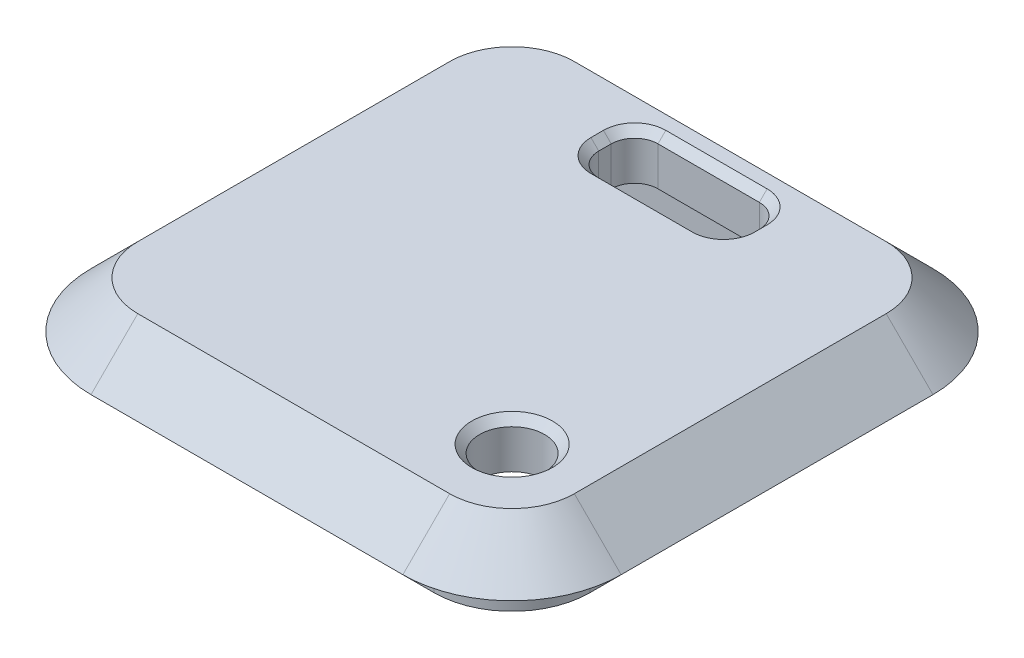
from build123d import *

# Parameters (mm, degrees)
CROQUIS1_W              = 34
CROQUIS1_H              = 34
SALIENTE_EXTRUIR1_DEPTH = 3
REDONDEO1_R             = 7
CHAFL_N1_SIZE           = 3
CROQUIS2_R              = 2.087433524
CROQUIS2_W              = 9.5
CROQUIS2_H              = 3.8
CORTAR_EXTRUIR1_DEPTH   = 25.228082879
REDONDEO2_R             = 1.5
CHAFL_N2_SIZE           = 0.5
SALIENTE_EXTRUIR2_DEPTH = 5
REDONDEO3_R             = 0.2
REDONDEO4_R             = 0.2
REDONDEO5_R             = 10
SALIENTE_EXTRUIR3_DEPTH = 2


with BuildPart() as part:
    # Croquis1 → Saliente-Extruir1 (new body)
    with BuildSketch(Plane(origin=(0, 0, 0), x_dir=(1, 0, 0), z_dir=(0, 1, 0))):
        Rectangle(CROQUIS1_W, CROQUIS1_H)
    extrude(amount=SALIENTE_EXTRUIR1_DEPTH)

    # Redondeo1
    redondeo1_edges = [part.edges().sort_by_distance(p)[0] for p in [
        (17, 1.5, 17),
        (-17, 1.5, 17),
        (-17, 1.5, -17),
        (17, 1.5, -17),
    ]]
    fillet(redondeo1_edges, radius=REDONDEO1_R)

    # Chaflán1
    chafl_n1_edges = [part.edges().sort_by_distance(p)[0] for p in [
        (17, 3, 0),
        (14.949747468, 3, -14.949747468),
        (14.949747468, 3, 14.949747468),
        (0, 3, -17),
        (0, 3, 17),
        (-14.949747468, 3, -14.949747468),
        (-14.949747468, 3, 14.949747468),
        (-17, 3, 0),
    ]]
    chamfer(chafl_n1_edges, length=CHAFL_N1_SIZE - 0.0001)  # a hair under: the kernel refuses the full size

    # Croquis2 → Cortar-Extruir1 (cut, through all)
    with BuildSketch(Plane(origin=(0, 3, 0), x_dir=(1, 0, 0), z_dir=(0, 1, 0))):
        with Locations(Location((9.259969099, -9.25223211, 0), (0, 0, 270))):
            Circle(CROQUIS2_R)
        with Locations((0, 10.712955835)):
            Rectangle(CROQUIS2_W, CROQUIS2_H)
    extrude(amount=-CORTAR_EXTRUIR1_DEPTH, mode=Mode.SUBTRACT)

    # Redondeo2
    redondeo2_edges = [part.edges().sort_by_distance(p)[0] for p in [
        (4.75, 1.5, -12.612955835),
        (4.75, 1.5, -8.812955835),
        (-4.75, 1.5, -8.812955835),
        (-4.75, 1.5, -12.612955835),
    ]]
    fillet(redondeo2_edges, radius=REDONDEO2_R)

    # Chaflán2
    chafl_n2_edges = [part.edges().sort_by_distance(p)[0] for p in [
        (9.259969099, 3, 7.164798586),
        (0, 3, -8.812955835),
        (-4.75, 3, -10.712955835),
        (4.75, 3, -10.712955835),
        (0, 3, -12.612955835),
        (-4.310660172, 3, -9.252295663),
        (4.310660172, 3, -9.252295663),
        (4.310660172, 3, -12.173616007),
        (-4.310660172, 3, -12.173616007),
    ]]
    chamfer(chafl_n2_edges, length=CHAFL_N2_SIZE)

    # Croquis3 → Saliente-Extruir2 (add, symmetric)
    with BuildSketch(Plane.XY):
        Polygon((-15.871019058, -6.008290377), (-14.471019058, -5.2), (-14.471019058, -3), (-15, 0), (-13, 0), (-12.471019058, -3), (-13, -8), align=None)
    extrude(amount=SALIENTE_EXTRUIR2_DEPTH, both=True)

    # Redondeo3
    redondeo3_edges = [part.edges().sort_by_distance(p)[0] for p in [
        (-13, -8, 0),
    ]]
    fillet(redondeo3_edges, radius=REDONDEO3_R)

    # Redondeo4
    redondeo4_edges = [part.edges().sort_by_distance(p)[0] for p in [
        (-15.871019058, -6.008290377, 0),
    ]]
    fillet(redondeo4_edges, radius=REDONDEO4_R)

    # Redondeo5
    redondeo5_edges = [part.edges().sort_by_distance(p)[0] for p in [
        (-14.471019058, -3, 0),
        (-12.471019058, -3, 0),
    ]]
    fillet(redondeo5_edges, radius=REDONDEO5_R)

    # Croquis4 → Saliente-Extruir3 (add)
    with BuildSketch(Plane.XZ):
        with BuildLine():
            Line((-10, 15), (10, 15))
            ThreePointArc((10, 15), (13.535533906, 13.535533906), (15, 10))
            Line((15, 10), (15, -10))
            ThreePointArc((15, -10), (13.535533906, -13.535533906), (10, -15))
            Line((10, -15), (-10, -15))
            ThreePointArc((-10, -15), (-13.535533906, -13.535533906), (-15, -10))
            Line((-15, -10), (-15, 10))
            ThreePointArc((-15, 10), (-13.535533906, 13.535533906), (-10, 15))
        make_face()
        with BuildLine():
            Line((-13, 10), (-13, -10))
            ThreePointArc((-13, -10), (-12.121320344, -12.121320344), (-10, -13))
            Line((-10, -13), (10, -13))
            ThreePointArc((10, -13), (12.121320344, -12.121320344), (13, -10))
            Line((13, -10), (13, 10))
            ThreePointArc((13, 10), (12.121320344, 12.121320344), (10, 13))
            Line((10, 13), (-10, 13))
            ThreePointArc((-10, 13), (-12.121320344, 12.121320344), (-13, 10))
        make_face(mode=Mode.SUBTRACT)
    extrude(amount=SALIENTE_EXTRUIR3_DEPTH)


solid = part.part
